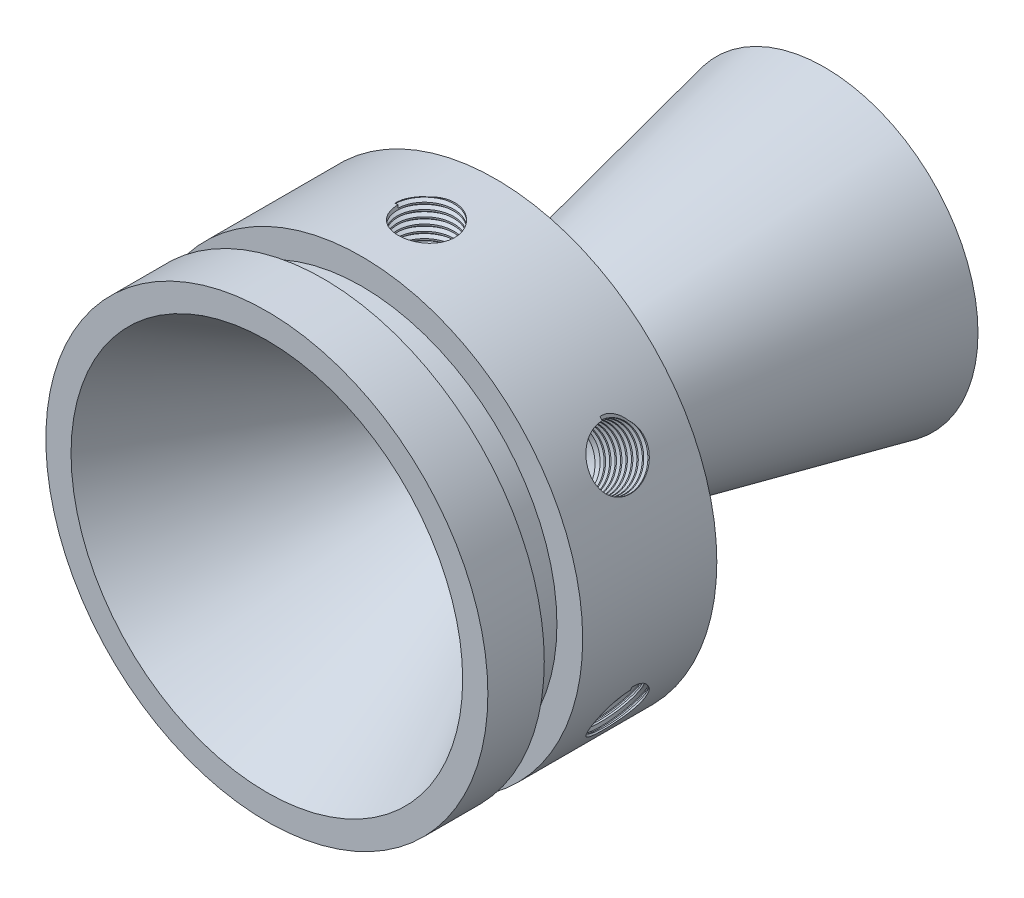
from build123d import *

# Parameters (mm, degrees)
ROSCA1_PITCH   = 0.5
MATRIZC1_COUNT = 6
MATRIZC2_COUNT = 6


with BuildPart() as part:
    # Croquis2 → Revolución1 (revolve)
    with BuildSketch(Plane(origin=(0, 0, 0), x_dir=(0, 0, -1), z_dir=(1, 0, 0)), mode=Mode.PRIVATE) as revoluci_n1_sk:
        with BuildLine():
            Line((0, 15.54), (17.473060549, 5.451923789))
            ThreePointArc((17.473060549, 5.451923789), (18.196603413, 5.152222521), (18.973060549, 5.05))
            Line((18.973060549, 5.05), (19.643691795, 5.05))
            ThreePointArc((19.643691795, 5.05), (20.166334111, 5.077390523), (20.683250249, 5.159261996))
            Line((20.683250249, 5.159261996), (44.263976077, 10.1715))
            Line((44.263976077, 10.1715), (44.263976077, 12.1715))
            Line((44.263976077, 12.1715), (20.169212971, 7.05))
            Line((20.169212971, 7.05), (18.169212971, 8.54))
            Line((18.169212971, 8.54), (18.169212971, 17.54))
            Line((18.169212971, 17.54), (7.524, 17.54))
            Line((7.524, 17.54), (7.524, 15.495108282))
            Line((7.524, 15.495108282), (4.476, 15.495108282))
            Line((4.476, 15.495108282), (4.476, 17.54))
            Line((4.476, 17.54), (0, 17.54))
            Line((0, 17.54), (0, 15.54))
        make_face()
    revolve(revoluci_n1_sk.sketch.rotate(Axis((0, 0, 14.017218159), (0, 0, -1)), 90), axis=Axis((0, 0, 14.017218159), (0, 0, -1)))

    # Croquis5 → M4 Clearance Hole1 (revolve, cut)
    with BuildSketch(Plane(origin=(0, 17.54, -12.669212971), x_dir=(0, 0, 1), z_dir=(1, 0, 0))):
        Polygon((0, 0), (0, 6.351936393), (2.25, 5), (2.25, 0), align=None)
    m4_clearance_hole1 = revolve(axis=Axis((0, 23.89, -12.669212971), (0, -1, 0)), mode=Mode.SUBTRACT)

    # Rosca1: the profile of Perfil de rosca1 profile screwed along a right-hand helix of 9 turns, 6 arcs to a turn; built about Z, then put on its axis
    rosca1_z = Axis((0, 0, 0), (0, 0, 1))
    rosca1_corners = [(2.2497, 0, -0.000173205), (2.520632937, 0, 0.156249999), (2.520632937, 0, 0.218749999), (2.2497, 0, 0.375173204)]
    with BuildLine(mode=Mode.PRIVATE) as rosca1_profile:
        Line(rosca1_corners[0], rosca1_corners[1])
        Line(rosca1_corners[1], rosca1_corners[2])
        Line(rosca1_corners[2], rosca1_corners[3])
        Line(rosca1_corners[3], rosca1_corners[0])
    rosca1_cap = Face(rosca1_profile.wire())
    rosca1_turn_angles = [0, 30, 60, 90, 120, 150, 180, 210, 240, 270, 300, 330, 360]
    rosca1_turn_weights = [1, 0.8660254037844387, 1, 0.8660254037844387, 1, 0.8660254037844387, 1, 0.8660254037844387, 1, 0.8660254037844387, 1, 0.8660254037844387, 1]
    rosca1_turn_rails = [Edge.make_bspline([Vector(p[0], p[1], 0).rotate(rosca1_z, rosca1_turn_angles[k]) / rosca1_turn_weights[k] + Vector(0, 0, p[2] + ROSCA1_PITCH * rosca1_turn_angles[k] / 360) for k in range(13)], [0, 0, 0, 1, 1, 2, 2, 3, 3, 4, 4, 5, 5, 6, 6, 6], 2, rosca1_turn_weights) for p in rosca1_corners]
    rosca1_turn_sides = [Face.make_surface_from_curves(rosca1_turn_rails[p[0]], rosca1_turn_rails[p[1]]) for p in [(0, 1), (1, 2), (2, 3), (3, 0)]]
    rosca1 = Plane(origin=(0, 17.54, -12.669212971), x_dir=(-1, 0, 0), z_dir=(0, -1, 0)) * Solid(Shell([*[p.moved(Location((0, 0, ROSCA1_PITCH * i))) for i in range(9) for p in rosca1_turn_sides], rosca1_cap, rosca1_cap.rotate(rosca1_z, 3240).moved(Location((0, 0, ROSCA1_PITCH * 3240 / 360)))]))
    add(rosca1, mode=Mode.SUBTRACT)

    # MatrizC1: M4 Clearance Hole1 ×6 about axis
    matrizc1_axis = Axis((0, 0, 14.017218159), (0, 0, 1))
    for i in range(1, MATRIZC1_COUNT):
        add(m4_clearance_hole1.rotate(matrizc1_axis, i * 360 / MATRIZC1_COUNT), mode=Mode.SUBTRACT)

    # MatrizC2: Rosca1 ×6 about axis
    matrizc2_axis = Axis((0, 0, 14.017218159), (0, 0, 1))
    for i in range(1, MATRIZC2_COUNT):
        add(rosca1.rotate(matrizc2_axis, i * 360 / MATRIZC2_COUNT), mode=Mode.SUBTRACT)


solid = part.part
